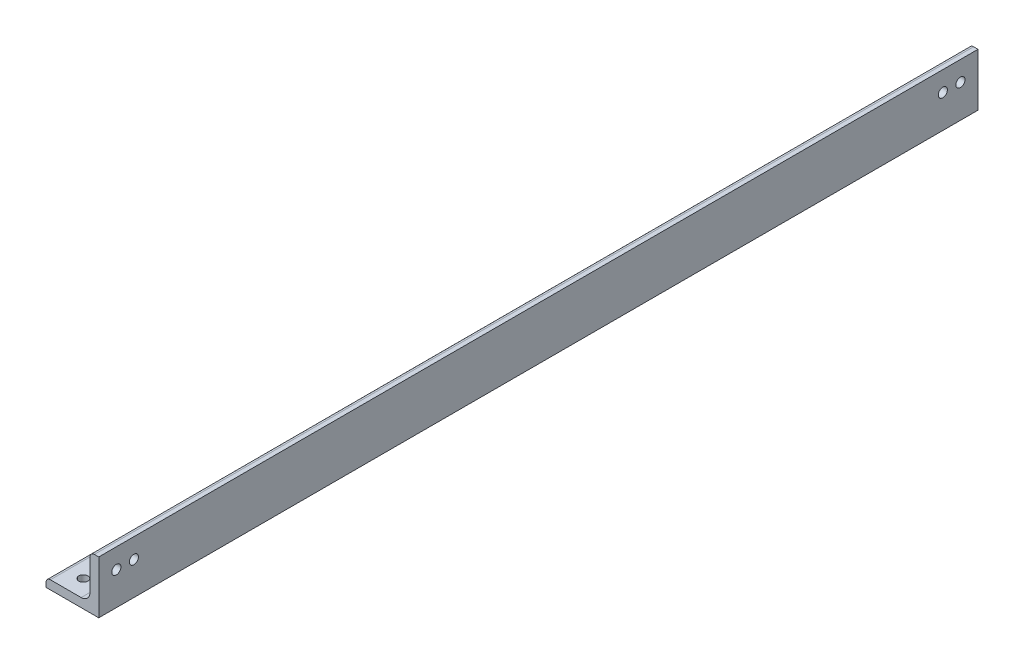
from build123d import *

# Parameters (mm, degrees)
BOSS_EXTRUDE1_DEPTH = 158.75
SKETCH3_R           = 1.651
CUT_EXTRUDE1_DEPTH  = 160.825854448
SKETCH4_R           = 1.651
CUT_EXTRUDE2_DEPTH  = 160.825854448


with BuildPart() as part:
    # Sketch2 → Boss-Extrude1 (new, symmetric)
    with BuildSketch(Plane.XY):
        with BuildLine():
            Line((-9.525, -9.525), (9.525, -9.525))
            Line((9.525, -9.525), (9.525, 9.525))
            Line((9.525, 9.525), (7.9375, 9.525))
            ThreePointArc((7.9375, 9.525), (6.814967985, 9.060032015), (6.35, 7.9375))
            Line((6.35, 7.9375), (6.35, -3.175))
            ThreePointArc((6.35, -3.175), (5.42006403, -5.42006403), (3.175, -6.35))
            Line((3.175, -6.35), (-7.9375, -6.35))
            ThreePointArc((-7.9375, -6.35), (-9.060032015, -6.814967985), (-9.525, -7.9375))
            Line((-9.525, -7.9375), (-9.525, -9.525))
        make_face()
    extrude(amount=BOSS_EXTRUDE1_DEPTH, both=True)

    # Sketch3 → Cut-Extrude1 (cut, through all)
    with BuildSketch(Plane(origin=(0, -6.35, 0), x_dir=(1, 0, 0), z_dir=(0, 1, 0))):
        with Locations((-2.38125, 152.4)):
            Circle(SKETCH3_R)
        with Locations((-2.38125, 146.05)):
            Circle(SKETCH3_R)
        with Locations((-2.38125, -146.05)):
            Circle(SKETCH3_R)
        with Locations((-2.38125, -152.4)):
            Circle(SKETCH3_R)
    extrude(amount=-CUT_EXTRUDE1_DEPTH, mode=Mode.SUBTRACT)

    # Sketch4 → Cut-Extrude2 (cut, through all)
    with BuildSketch(Plane.ZY.offset(-6.35)):
        with Locations((-152.4, 2.38125)):
            Circle(SKETCH4_R)
        with Locations((-146.05, 2.38125)):
            Circle(SKETCH4_R)
        with Locations((146.05, 2.38125)):
            Circle(SKETCH4_R)
        with Locations((152.4, 2.38125)):
            Circle(SKETCH4_R)
    extrude(amount=-CUT_EXTRUDE2_DEPTH, mode=Mode.SUBTRACT)


solid = part.part
